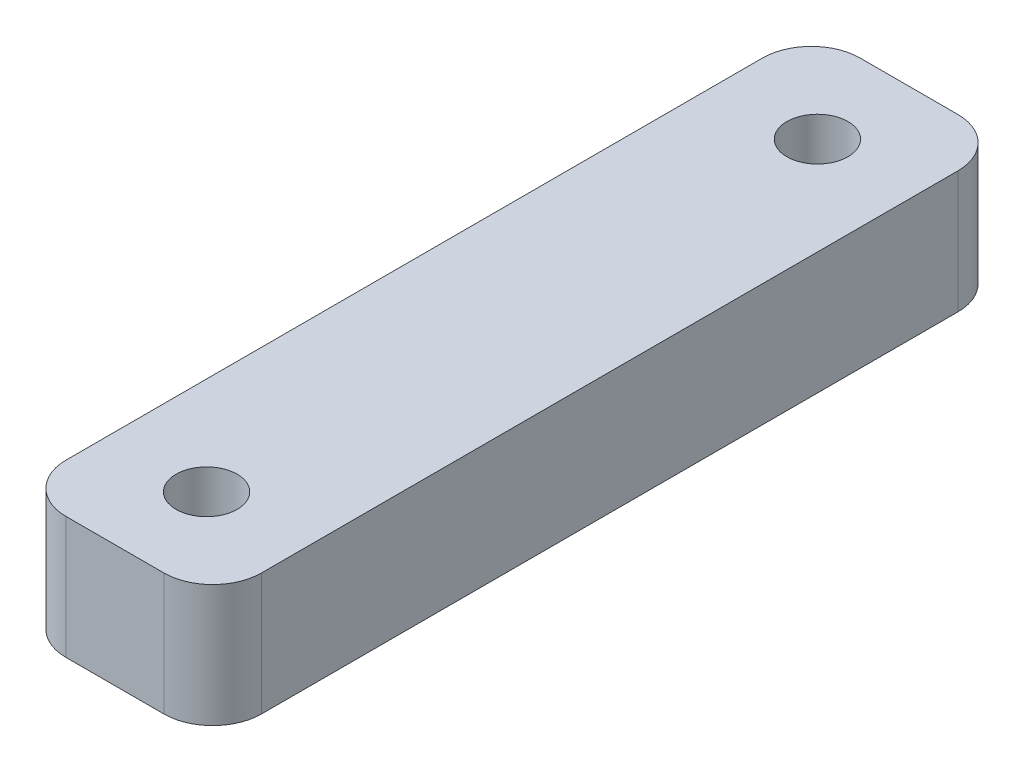
from build123d import *

# Parameters (mm, degrees)
ESQUISSE1_W             = 16
ESQUISSE1_H             = 10
BOSS_EXTRU_1_DEPTH      = 65
ESQUISSE2_R             = 2.5
ENL_V_MAT_EXTRU_1_DEPTH = 67.2495283
CONG_1_R                = 4


with BuildPart() as part:
    # Esquisse1 → Boss.-Extru.1 (new body)
    with BuildSketch(Plane.XY):
        Rectangle(ESQUISSE1_W, ESQUISSE1_H)
    extrude(amount=BOSS_EXTRU_1_DEPTH)

    # Esquisse2 → Enlèv. mat.-Extru.1 (cut, through all)
    with BuildSketch(Plane(origin=(0, 5, 0), x_dir=(1, 0, 0), z_dir=(0, 1, 0))):
        with Locations((0, -7.5)):
            Circle(ESQUISSE2_R)
        with Locations((0, -57.5)):
            Circle(ESQUISSE2_R)
    extrude(amount=-ENL_V_MAT_EXTRU_1_DEPTH, mode=Mode.SUBTRACT)

    # Congé1
    cong_1_edges = [part.edges().sort_by_distance(p)[0] for p in [
        (-8, 0, 0),
        (-8, 0, 65),
        (8, 0, 65),
        (8, 0, 0),
    ]]
    fillet(cong_1_edges, radius=CONG_1_R)


solid = part.part
